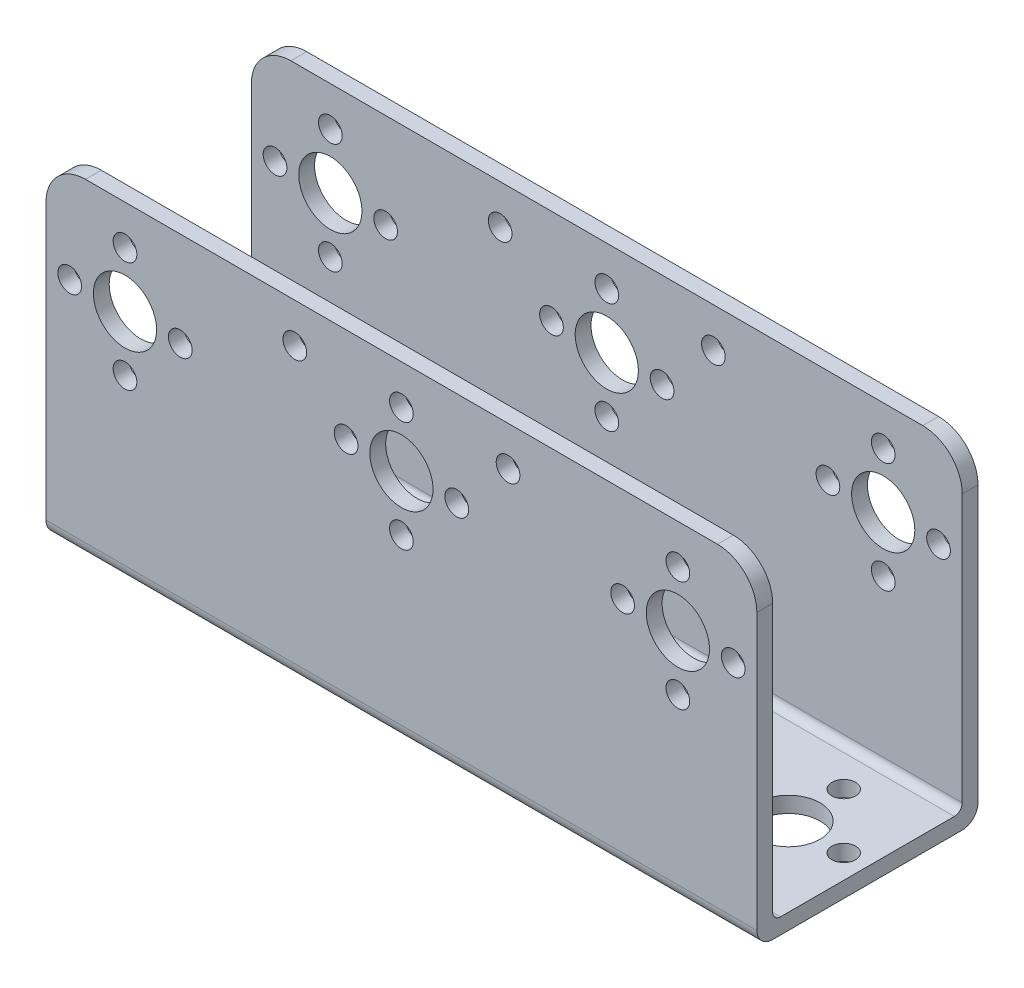
from build123d import *

# Parameters (mm, degrees)
ESTRUSIONE_ESTRUSIONE1_DEPTH = 2
SCHIZZO2_W                   = 90
SCHIZZO2_H                   = 28
ESTRUSIONE_ESTRUSIONE2_DEPTH = 2
ESTRUSIONE_ESTRUSIONE3_START = 2
ESTRUSIONE_ESTRUSIONE3_DEPTH = 2
SCHIZZO5_R                   = 4
SCHIZZO5_R_2                 = 1.5
TAGLIO_ESTRUSIONE1_DEPTH     = 104.132432046
RACCORDO1_R                  = 2
RACCORDO2_R                  = 2
RACCORDO3_R                  = 1
RACCORDO4_R                  = 1
SCHIZZO6_R                   = 4
SCHIZZO6_R_2                 = 1.5
TAGLIO_ESTRUSIONE2_DEPTH     = 104.132432046
CUT_EXTRUDE1_DEPTH           = 104.132432046
CUT_EXTRUDE1_DEPTH_BACK      = 104.132432046
SKETCH1_R                    = 1.5


with BuildPart() as part:
    # Schizzo1 → Estrusione-Estrusione1 (new body)
    with BuildSketch(Plane.XY):
        with BuildLine():
            Line((0, 0), (90, 0))
            Line((90, 0), (90, 36.860465116))
            ThreePointArc((90, 36.860465116), (88.535533906, 40.395999022), (85, 41.860465116))
            Line((85, 41.860465116), (5, 41.860465116))
            ThreePointArc((5, 41.860465116), (1.464466094, 40.395999022), (0, 36.860465116))
            Line((0, 36.860465116), (0, 0))
        make_face()
    extrude(amount=-ESTRUSIONE_ESTRUSIONE1_DEPTH)

    # Schizzo2 → Estrusione-Estrusione2 (add)
    with BuildSketch(Plane(origin=(0, 0, 0), x_dir=(1, 0, 0), z_dir=(0, 1, 0))):
        with Locations((45, 14)):
            Rectangle(SCHIZZO2_W, SCHIZZO2_H)
    extrude(amount=ESTRUSIONE_ESTRUSIONE2_DEPTH)

    # Schizzo4 → Estrusione-Estrusione3 (add)
    with BuildSketch(Plane.XY.offset(-28).offset(ESTRUSIONE_ESTRUSIONE3_START)):
        with BuildLine():
            Line((90, 0), (90, 36.860465116))
            ThreePointArc((90, 36.860465116), (88.535533906, 40.395999022), (85, 41.860465116))
            Line((85, 41.860465116), (5, 41.860465116))
            ThreePointArc((5, 41.860465116), (1.464466094, 40.395999022), (0, 36.860465116))
            Line((0, 36.860465116), (0, 0))
            Line((0, 0), (90, 0))
        make_face()
    extrude(amount=-ESTRUSIONE_ESTRUSIONE3_DEPTH)

    # Schizzo5 → Taglio-Estrusione1 (cut, through all)
    with BuildSketch(Plane.XY):
        with Locations((10, 29.860465116)):
            Circle(SCHIZZO5_R)
        with Locations((45, 29.860465116)):
            Circle(SCHIZZO5_R)
        with Locations((80, 29.860465116)):
            Circle(SCHIZZO5_R)
        with Locations((10, 36.860465116)):
            Circle(SCHIZZO5_R_2)
        with Locations((3, 29.860465116)):
            Circle(SCHIZZO5_R_2)
        with Locations((10, 22.860465116)):
            Circle(SCHIZZO5_R_2)
        with Locations((17, 29.860465116)):
            Circle(SCHIZZO5_R_2)
        with Locations((38, 29.860465116)):
            Circle(SCHIZZO5_R_2)
        with Locations((45, 36.860465116)):
            Circle(SCHIZZO5_R_2)
        with Locations((80, 36.860465116)):
            Circle(SCHIZZO5_R_2)
        with Locations((73, 29.860465116)):
            Circle(SCHIZZO5_R_2)
        with Locations((45, 22.860465116)):
            Circle(SCHIZZO5_R_2)
        with Locations((80, 22.860465116)):
            Circle(SCHIZZO5_R_2)
        with Locations((87, 29.860465116)):
            Circle(SCHIZZO5_R_2)
        with Locations((52, 29.860465116)):
            Circle(SCHIZZO5_R_2)
    extrude(amount=-TAGLIO_ESTRUSIONE1_DEPTH, mode=Mode.SUBTRACT)

    # Raccordo1
    raccordo1_edges = [part.edges().sort_by_distance(p)[0] for p in [
        (45, 0, -28),
    ]]
    fillet(raccordo1_edges, radius=RACCORDO1_R)

    # Raccordo2
    raccordo2_edges = [part.edges().sort_by_distance(p)[0] for p in [
        (45, 0, 0),
    ]]
    fillet(raccordo2_edges, radius=RACCORDO2_R)

    # Raccordo3
    raccordo3_edges = [part.edges().sort_by_distance(p)[0] for p in [
        (45, 2, -2),
    ]]
    fillet(raccordo3_edges, radius=RACCORDO3_R)

    # Raccordo4
    raccordo4_edges = [part.edges().sort_by_distance(p)[0] for p in [
        (45, 2, -26),
    ]]
    fillet(raccordo4_edges, radius=RACCORDO4_R)

    # Schizzo6 → Taglio-Estrusione2 (cut, through all)
    with BuildSketch(Plane(origin=(0, 0, 0), x_dir=(1, 0, 0), z_dir=(0, 1, 0))):
        with Locations((45, 14)):
            Circle(SCHIZZO6_R)
        with Locations((10, 14)):
            Circle(SCHIZZO6_R)
        with Locations((80, 14)):
            Circle(SCHIZZO6_R)
        with Locations((10, 21)):
            Circle(SCHIZZO6_R_2)
        with Locations((3, 14)):
            Circle(SCHIZZO6_R_2)
        with Locations((10, 7)):
            Circle(SCHIZZO6_R_2)
        with Locations((17, 14)):
            Circle(SCHIZZO6_R_2)
        with Locations((38, 14)):
            Circle(SCHIZZO6_R_2)
        with Locations((45, 21)):
            Circle(SCHIZZO6_R_2)
        with Locations((80, 21)):
            Circle(SCHIZZO6_R_2)
        with Locations((80, 7)):
            Circle(SCHIZZO6_R_2)
        with Locations((45, 7)):
            Circle(SCHIZZO6_R_2)
        with Locations((52, 14)):
            Circle(SCHIZZO6_R_2)
        with Locations((87, 14)):
            Circle(SCHIZZO6_R_2)
        with Locations((73, 14)):
            Circle(SCHIZZO6_R_2)
    extrude(amount=TAGLIO_ESTRUSIONE2_DEPTH, mode=Mode.SUBTRACT)

    # Sketch1 → Cut-Extrude1 (cut, two sides: drawn at the far end of the back side and taken through both)
    with BuildSketch(Plane.XY.offset(-CUT_EXTRUDE1_DEPTH_BACK)):
        with Locations((31.5, 36.860465116)):
            Circle(SKETCH1_R)
        with Locations((58.5, 36.860465116)):
            Circle(SKETCH1_R)
    extrude(amount=CUT_EXTRUDE1_DEPTH + CUT_EXTRUDE1_DEPTH_BACK, mode=Mode.SUBTRACT)


solid = part.part
